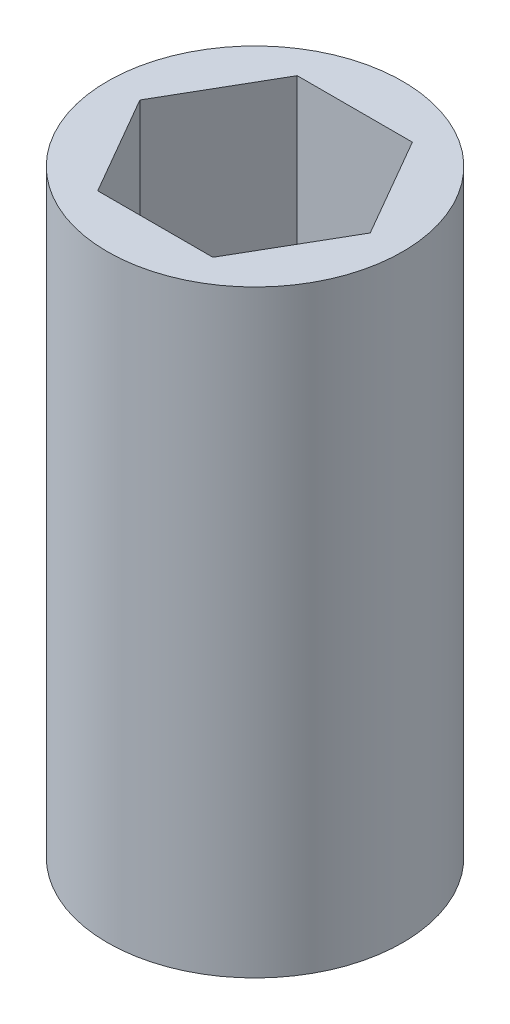
from build123d import *

# Parameters (mm, degrees)
SKETCH1_R           = 7.14375
BOSS_EXTRUDE1_DEPTH = 14.478


with BuildPart() as part:
    # Sketch1 → Boss-Extrude1 (new, symmetric)
    with BuildSketch(Plane(origin=(0, 0, 0), x_dir=(1, 0, 0), z_dir=(0, 1, 0))):
        Circle(SKETCH1_R)
        Polygon((2.786292399, -4.826), (5.572584798, 0), (2.786292399, 4.826), (-2.786292399, 4.826), (-5.572584798, 0), (-2.786292399, -4.826), align=None, mode=Mode.SUBTRACT)
    extrude(amount=BOSS_EXTRUDE1_DEPTH, both=True)


solid = part.part
